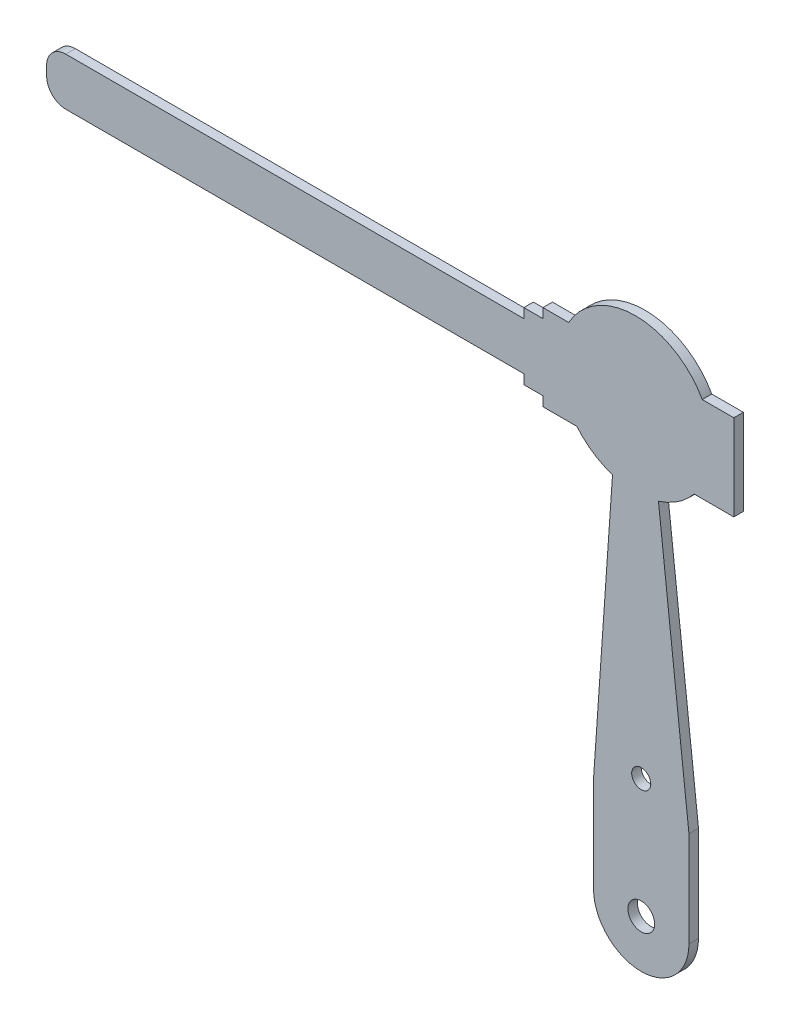
from build123d import *

# Parameters (mm, degrees)
MODEL_R           = 1.4
MODEL_R_2         = 1
BRIDA_BASE1_DEPTH = 1


# Sheet-metal steps are written as plain solids
with BuildPart() as part:
    # Model → Brida base1 (new body)
    with BuildSketch(Plane.XY):
        with BuildLine():
            Line((40.2059904, -5.7615616), (42.197855138, 22.819737764))
            ThreePointArc((42.197855138, 22.819737764), (40.144837503, 23.807467685), (38.45349381, 25.333851753))
            Line((38.45349381, 25.333851753), (34.906389557, 25.333851753))
            Line((34.906389557, 25.333851753), (34.906389557, 26.333851753))
            Line((34.906389557, 26.333851753), (32.906389557, 26.333851753))
            Line((32.906389557, 26.333851753), (32.906389557, 27.333851753))
            Line((32.906389557, 27.333851753), (-15.093610443, 27.333851753))
            ThreePointArc((-15.093610443, 27.333851753), (-16.507824005, 27.919638191), (-17.093610443, 29.333851753))
            Line((-17.093610443, 29.333851753), (-17.093610443, 30.333851753))
            ThreePointArc((-17.093610443, 30.333851753), (-16.507824005, 31.748065316), (-15.093610443, 32.333851753))
            Line((-15.093610443, 32.333851753), (32.906389557, 32.333851753))
            Line((32.906389557, 32.333851753), (32.906389557, 33.333851753))
            Line((32.906389557, 33.333851753), (34.906389557, 33.333851753))
            Line((34.906389557, 33.333851753), (34.906389557, 34.333851753))
            Line((34.906389557, 34.333851753), (37.610831115, 34.333851753))
            ThreePointArc((37.610831115, 34.333851753), (44.604363348, 38.449201588), (51.597895581, 34.333851753))
            Line((51.597895581, 34.333851753), (54.906389557, 34.333851753))
            Line((54.906389557, 34.333851753), (54.906389557, 25.333851753))
            Line((54.906389557, 25.333851753), (50.755232885, 25.333851753))
            ThreePointArc((50.755232885, 25.333851753), (49.063889193, 23.807467685), (47.010871557, 22.819737764))
            Line((47.010871557, 22.819737764), (50.2059904, -5.7615616))
            Line((50.2059904, -5.7615616), (50.2059904, -15.7615616))
            ThreePointArc((50.2059904, -15.7615616), (45.2059904, -20.7615616), (40.2059904, -15.7615616))
            Line((40.2059904, -15.7615616), (40.2059904, -5.7615616))
        make_face()
        with Locations((45.2059904, -15.7615616)):
            Circle(MODEL_R, mode=Mode.SUBTRACT)
        with Locations((45.2059904, -3.2615616)):
            Circle(MODEL_R_2, mode=Mode.SUBTRACT)
    extrude(amount=-BRIDA_BASE1_DEPTH)


solid = part.part
